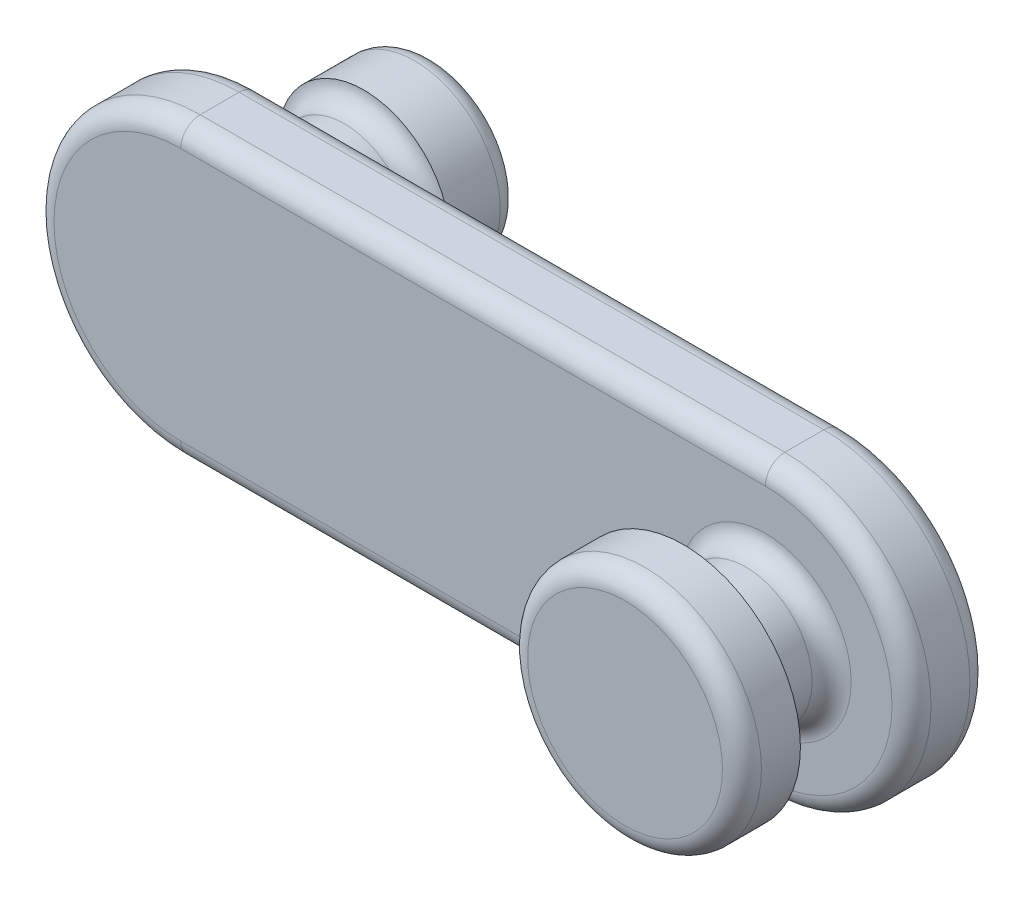
from build123d import *

# Parameters (mm, degrees)
SKETCH1_R           = 3.5
BOSS_EXTRUDE2_DEPTH = 4
SKETCH2_R           = 3.4
BOSS_EXTRUDE3_DEPTH = 5.4
SKETCH4_R           = 4.4
BOSS_EXTRUDE4_DEPTH = 3.6
SKETCH5_R           = 3.5
BOSS_EXTRUDE5_DEPTH = 4
SKETCH6_R           = 3.4
BOSS_EXTRUDE6_DEPTH = 4.2
SKETCH7_R           = 6
BOSS_EXTRUDE7_DEPTH = 3
FILLET1_R           = 1


with BuildPart() as part:
    # Sketch1 → Boss-Extrude2 (new body)
    with BuildSketch(Plane.XY):
        with BuildLine():
            Line((-15, 7.5), (15, 7.5))
            ThreePointArc((15, 7.5), (22.5, 0), (15, -7.5))
            Line((15, -7.5), (-15, -7.5))
            ThreePointArc((-15, -7.5), (-22.5, 0), (-15, 7.5))
        make_face()
        with Locations((15, 0)):
            Circle(SKETCH1_R, mode=Mode.SUBTRACT)
    extrude(amount=BOSS_EXTRUDE2_DEPTH)

    # Sketch2 → Boss-Extrude3 (add)
    with BuildSketch(Plane(origin=(0, 0, 0), x_dir=(-1, 0, 0), z_dir=(0, 0, -1))):
        with Locations(Location((15, 0, 0), (0, 0, 180))):
            Circle(SKETCH2_R)
    extrude(amount=BOSS_EXTRUDE3_DEPTH)

    # Sketch4 → Boss-Extrude4 (add)
    with BuildSketch(Plane(origin=(0, 0, -5.4), x_dir=(-1, 0, 0), z_dir=(0, 0, -1))):
        with Locations((15, 0)):
            Circle(SKETCH4_R)
    extrude(amount=BOSS_EXTRUDE4_DEPTH)

    # Sketch5 → Boss-Extrude5 (add)
    with BuildSketch(Plane(origin=(0, 0, 0), x_dir=(-1, 0, 0), z_dir=(0, 0, -1))):
        with Locations((-15, 0)):
            Circle(SKETCH5_R)
    extrude(amount=-BOSS_EXTRUDE5_DEPTH)

    # Sketch6 → Boss-Extrude6 (add)
    with BuildSketch(Plane.XY.offset(4)):
        with Locations((15, 0)):
            Circle(SKETCH6_R)
    extrude(amount=BOSS_EXTRUDE6_DEPTH)

    # Sketch7 → Boss-Extrude7 (add)
    with BuildSketch(Plane.XY.offset(8.2)):
        with Locations((15, 0)):
            Circle(SKETCH7_R)
    extrude(amount=BOSS_EXTRUDE7_DEPTH)

    # Fillet1
    fillet1_edges = [part.edges().sort_by_distance(p)[0] for p in [
        (22.5, 0, 4),
        (0, 7.5, 4),
        (-18.4, 0, 0),
        (-18.4, 0, -5.4),
        (-10.6, 0, -9),
        (11.6, 0, 4),
        (11.6, 0, 8.2),
        (9, 0, 11.2),
        (-22.5, 0, 4),
        (0, 7.5, 0),
        (22.5, 0, 0),
        (0, -7.5, 0),
        (-22.5, 0, 0),
        (0, -7.5, 4),
    ]]
    fillet(fillet1_edges, radius=FILLET1_R - 0.0001)  # a hair under: the kernel refuses the full size


solid = part.part
